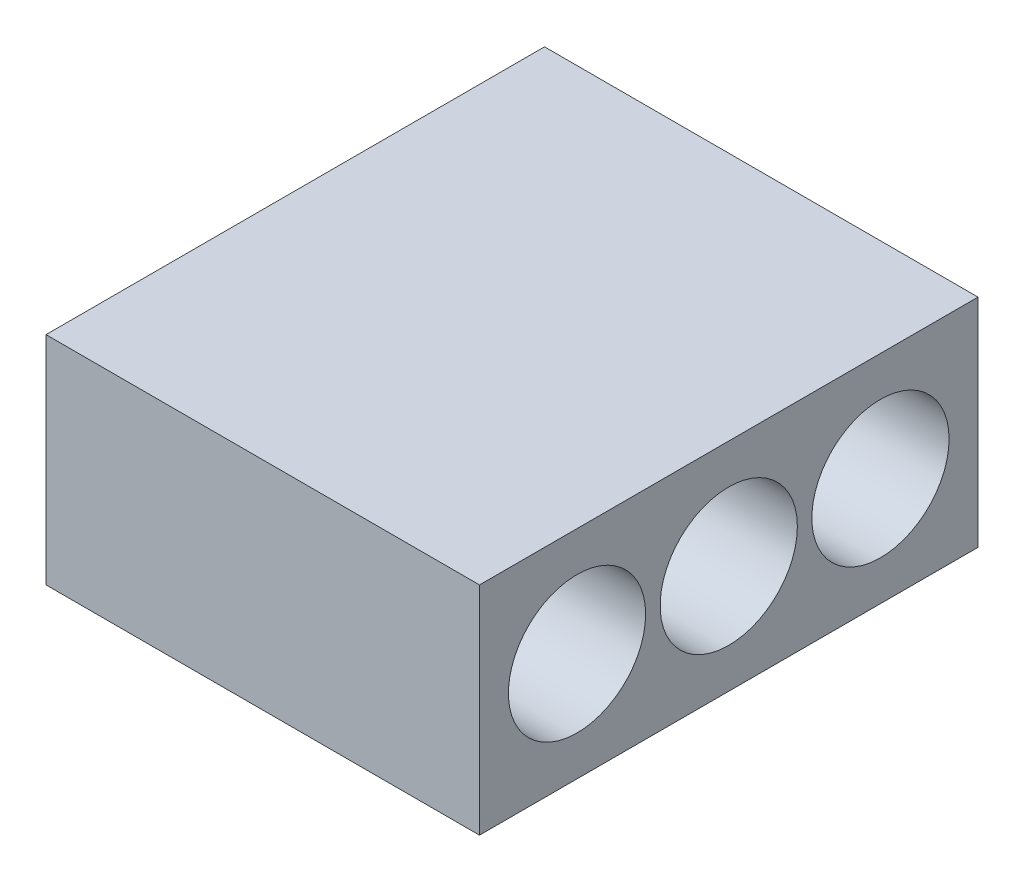
from build123d import *

# Parameters (mm, degrees)
SKETCH1_W           = 100
SKETCH1_H           = 115
BOSS_EXTRUDE1_DEPTH = 50
CUT_EXTRUDE2_REACH  = 162.39
SKETCH3_R           = 15.83


with BuildPart() as part:
    # Sketch1 → Boss-Extrude1 (new body)
    with BuildSketch(Plane(origin=(0, 0, 0), x_dir=(1, 0, 0), z_dir=(0, 1, 0))):
        with Locations((50, 57.5)):
            Rectangle(SKETCH1_W, SKETCH1_H)
    extrude(amount=BOSS_EXTRUDE1_DEPTH)

    # Sketch3 → Cut-Extrude2 (cut, up to next)
    with BuildSketch(Plane(origin=(100, 0, 0), x_dir=(0, 0, -1), z_dir=(1, 0, 0)), mode=Mode.PRIVATE) as cut_extrude2_sk1:
        with Locations((57.5, 25)):
            Circle(SKETCH3_R)
    cut_extrude2_tool1 = extrude(cut_extrude2_sk1.sketch, amount=-CUT_EXTRUDE2_REACH, mode=Mode.PRIVATE) & part.part
    # Sketch3 → Cut-Extrude2 (cut, up to next)
    with BuildSketch(Plane(origin=(100, 0, 0), x_dir=(0, 0, -1), z_dir=(1, 0, 0)), mode=Mode.PRIVATE) as cut_extrude2_sk2:
        with Locations((92.5, 25)):
            Circle(SKETCH3_R)
    cut_extrude2_tool2 = extrude(cut_extrude2_sk2.sketch, amount=-CUT_EXTRUDE2_REACH, mode=Mode.PRIVATE) & part.part
    # Sketch3 → Cut-Extrude2 (cut, up to next)
    with BuildSketch(Plane(origin=(100, 0, 0), x_dir=(0, 0, -1), z_dir=(1, 0, 0)), mode=Mode.PRIVATE) as cut_extrude2_sk3:
        with Locations((22.5, 25)):
            Circle(SKETCH3_R)
    cut_extrude2_tool3 = extrude(cut_extrude2_sk3.sketch, amount=-CUT_EXTRUDE2_REACH, mode=Mode.PRIVATE) & part.part
    add(cut_extrude2_tool1.solids().sort_by_distance((100, 25, -57.5))[0], mode=Mode.SUBTRACT)
    add(cut_extrude2_tool2.solids().sort_by_distance((100, 25, -92.5))[0], mode=Mode.SUBTRACT)
    add(cut_extrude2_tool3.solids().sort_by_distance((100, 25, -22.5))[0], mode=Mode.SUBTRACT)


solid = part.part
